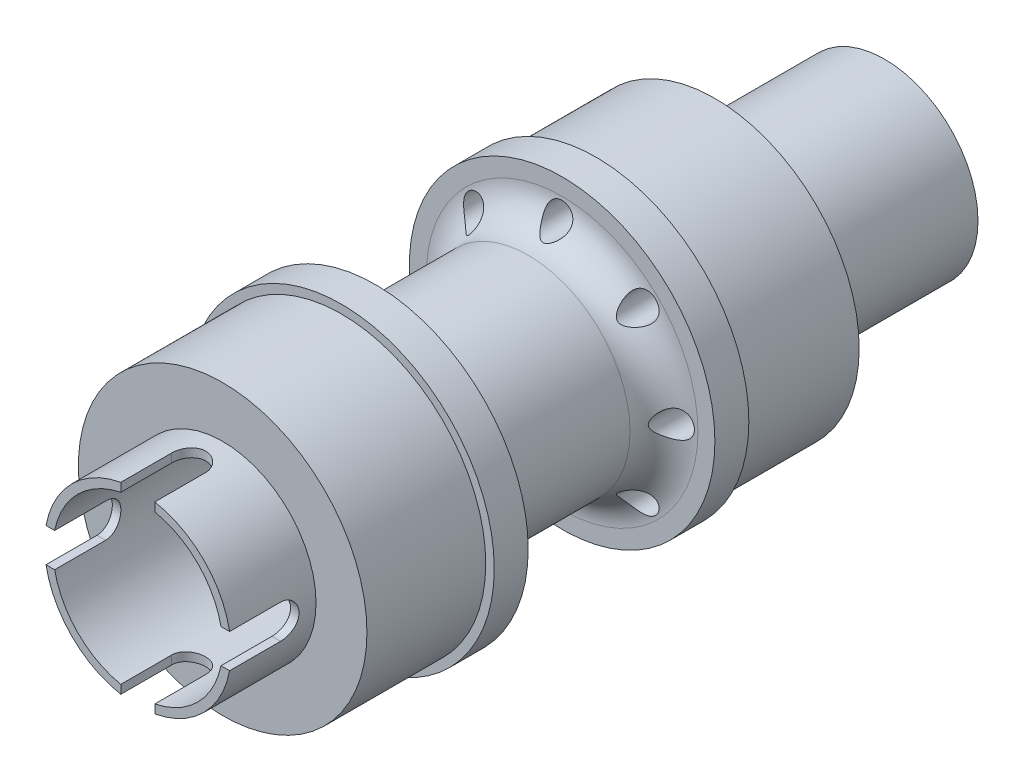
from build123d import *

# Parameters (mm, degrees)
ESQUISSE1_R                                   = 5.5
ESQUISSE1_R_2                                 = 4.5
BOSS_EXTRU_1_DEPTH                            = 10
ESQUISSE3_R                                   = 8.5
ESQUISSE3_R_2                                 = 5
BOSS_EXTRU_3_DEPTH                            = 7
ESQUISSE4_R                                   = 9
ESQUISSE4_R_2                                 = 5
BOSS_EXTRU_4_DEPTH                            = 2
ESQUISSE7_R                                   = 6
ESQUISSE7_R_2                                 = 5
BOSS_EXTRU_7_DEPTH                            = 11
ESQUISSE8_R                                   = 9
ESQUISSE8_R_2                                 = 5
BOSS_EXTRU_8_DEPTH                            = 2
ESQUISSE15_R                                  = 8.5
ESQUISSE15_R_2                                = 5
BOSS_EXTRU_9_DEPTH                            = 7
ESQUISSE16_R                                  = 5.5
ESQUISSE16_R_2                                = 5
BOSS_EXTRU_10_DEPTH                           = 5
ESQUISSE17_W                                  = 20
ESQUISSE17_H                                  = 2
ESQUISSE17_W_2                                = 2
ESQUISSE17_H_2                                = 20
ENL_V_MAT_EXTRU_1_DEPTH                       = 4
TROU_POUR_TARAUDAGE_POUR_TROU_TARAUD_M2_D     = 1.6
TROU_POUR_TARAUDAGE_POUR_TROU_TARAUD_M2_DEPTH = 9
CONG_1_R                                      = 2
CONG_5_R                                      = 1
CONG_6_START                                  = 5.354529638
CONG_6_DEPTH                                  = 0.053797275
CONG_6_START_2                                = 4.898979297
CONG_6_2_DEPTH                                = 0.601020703
CONG_6_START_3                                = 40
CONG_6_3_DEPTH                                = 4.0000001
CONG_7_R                                      = 1
CONG_8_R                                      = 1


with BuildPart() as part:
    # Esquisse1 → Boss.-Extru.1 (new body)
    with BuildSketch(Plane.XY):
        Circle(ESQUISSE1_R)
        Circle(ESQUISSE1_R_2, mode=Mode.SUBTRACT)
    extrude(amount=BOSS_EXTRU_1_DEPTH)

    # Esquisse3 → Boss.-Extru.3 (add)
    with BuildSketch(Plane.XY.offset(10)):
        Circle(ESQUISSE3_R)
        Circle(ESQUISSE3_R_2, mode=Mode.SUBTRACT)
    extrude(amount=BOSS_EXTRU_3_DEPTH)

    # Esquisse4 → Boss.-Extru.4 (add)
    with BuildSketch(Plane.XY.offset(17)):
        Circle(ESQUISSE4_R)
        Circle(ESQUISSE4_R_2, mode=Mode.SUBTRACT)
    extrude(amount=BOSS_EXTRU_4_DEPTH)

    # Esquisse7 → Boss.-Extru.7 (add)
    with BuildSketch(Plane.XY.offset(19)):
        Circle(ESQUISSE7_R)
        Circle(ESQUISSE7_R_2, mode=Mode.SUBTRACT)
    extrude(amount=BOSS_EXTRU_7_DEPTH)

    # Esquisse8 → Boss.-Extru.8 (add)
    with BuildSketch(Plane.XY.offset(30)):
        Circle(ESQUISSE8_R)
        Circle(ESQUISSE8_R_2, mode=Mode.SUBTRACT)
    extrude(amount=BOSS_EXTRU_8_DEPTH)

    # Esquisse15 → Boss.-Extru.9 (add)
    with BuildSketch(Plane.XY.offset(32)):
        Circle(ESQUISSE15_R)
        Circle(ESQUISSE15_R_2, mode=Mode.SUBTRACT)
    extrude(amount=BOSS_EXTRU_9_DEPTH)

    # Esquisse16 → Boss.-Extru.10 (add)
    with BuildSketch(Plane.XY.offset(39)):
        Circle(ESQUISSE16_R)
        Circle(ESQUISSE16_R_2, mode=Mode.SUBTRACT)
    extrude(amount=BOSS_EXTRU_10_DEPTH)

    # Esquisse17 → Enlèv. mat.-Extru.1 (cut)
    with BuildSketch(Plane.XY.offset(44)):
        Rectangle(ESQUISSE17_W, ESQUISSE17_H)
        Rectangle(ESQUISSE17_W_2, ESQUISSE17_H_2)
    extrude(amount=-ENL_V_MAT_EXTRU_1_DEPTH, mode=Mode.SUBTRACT)

    # Trou pour taraudage pour trou taraudé M21
    with Locations(Plane(origin=(0, 0, 10), x_dir=(-1, 0, 0), z_dir=(0, 0, -1))):
        with Locations((-7, 0), (-4.949747468, 4.949747468), (0, 7), (4.949747468, 4.949747468), (7, 0), (4.949747468, -4.949747468), (0, -7), (-4.949747468, -4.949747468), (0, 0)):
            Hole(TROU_POUR_TARAUDAGE_POUR_TROU_TARAUD_M2_D / 2, depth=TROU_POUR_TARAUDAGE_POUR_TROU_TARAUD_M2_DEPTH)

    # Congé1
    # the kernel refuses this fillet: 2 mm, written as the material it adds along each edge
    with BuildSketch(Plane(origin=(0, 0, 30), x_dir=(1, 0, 0), z_dir=(0, -1, 0))) as cong_1_piece_1:
        with BuildLine():
            CenterArc((6 + CONG_1_R, -CONG_1_R), CONG_1_R, 90, 90)
            Line((6 + CONG_1_R, 0), (6, 0))
            Line((6, 0), (6, -CONG_1_R))
        make_face()
    revolve(axis=Axis((0, 0, 30), (0, 0, 1)))
    with BuildSketch(Plane(origin=(0, 0, 19), x_dir=(1, 0, 0), z_dir=(0, -1, 0))) as cong_1_piece_2_section:
        with BuildLine():
            CenterArc((6 + CONG_1_R, CONG_1_R), CONG_1_R, 180, 90)
            Line((6, CONG_1_R), (6, 0))
            Line((6, 0), (6 + CONG_1_R, 0))
        make_face()
    cong_1_piece_2 = revolve(axis=Axis((0, 0, 19), (0, 0, 1)), mode=Mode.PRIVATE)
    cong_1_piece_2 = cong_1_piece_2 - Plane(origin=(-4.949747468, -4.949747468, 19), x_dir=(1, 0, 0), z_dir=(0, 0, 1)) * Cylinder(0.8, 32, mode=Mode.PRIVATE)
    cong_1_piece_2 = cong_1_piece_2 - Plane(origin=(0, -7, 19), x_dir=(1, 0, 0), z_dir=(0, 0, 1)) * Cylinder(0.8, 32, mode=Mode.PRIVATE)
    cong_1_piece_2 = cong_1_piece_2 - Plane(origin=(4.949747468, -4.949747468, 19), x_dir=(1, 0, 0), z_dir=(0, 0, 1)) * Cylinder(0.8, 32, mode=Mode.PRIVATE)
    cong_1_piece_2 = cong_1_piece_2 - Plane(origin=(-7, 0, 19), x_dir=(1, 0, 0), z_dir=(0, 0, 1)) * Cylinder(0.8, 32, mode=Mode.PRIVATE)
    cong_1_piece_2 = cong_1_piece_2 - Plane(origin=(-4.949747468, 4.949747468, 19), x_dir=(1, 0, 0), z_dir=(0, 0, 1)) * Cylinder(0.8, 32, mode=Mode.PRIVATE)
    cong_1_piece_2 = cong_1_piece_2 - Plane(origin=(7, 0, 19), x_dir=(1, 0, 0), z_dir=(0, 0, 1)) * Cylinder(0.8, 32, mode=Mode.PRIVATE)
    cong_1_piece_2 = cong_1_piece_2 - Plane(origin=(0, 7, 19), x_dir=(1, 0, 0), z_dir=(0, 0, 1)) * Cylinder(0.8, 32, mode=Mode.PRIVATE)
    cong_1_piece_2 = cong_1_piece_2 - Plane(origin=(4.949747468, 4.949747468, 19), x_dir=(1, 0, 0), z_dir=(0, 0, 1)) * Cylinder(0.8, 32, mode=Mode.PRIVATE)
    add(cong_1_piece_2)

    # Congé5
    cong_5_edges = [part.edges().sort_by_distance(p)[0] for p in [
        (1, -5.153653199, 40),
        (-1, -5.153653199, 40),
    ]]
    fillet(cong_5_edges, radius=CONG_5_R - 0.0001)  # a hair under: the kernel refuses the full size

    # Congé6: read off the stored shape, not the designer's step
    # Congé6 outline → Congé6 (add)
    with BuildSketch(Plane.YZ.offset(CONG_6_START)):
        with BuildLine():
            ThreePointArc((1, 41), (0.707106781, 40.292893219), (0, 40))
            Line((0, 40), (1, 40))
            Line((1, 40), (1, 41))
        make_face()
        with BuildLine():
            ThreePointArc((0, 40), (-0.707106781, 40.292893219), (-1, 41))
            Line((-1, 41), (-1, 40))
            Line((-1, 40), (0, 40))
        make_face()
    extrude(amount=CONG_6_DEPTH)

    # Cong_6 2 outline → Cong_6 2 (add)
    with BuildSketch(Plane.YZ.offset(CONG_6_START_2)):
        with BuildLine():
            ThreePointArc((1, 41), (0.707106781, 40.292893219), (0, 40))
            Line((0, 40), (1, 40))
            Line((1, 40), (1, 41))
        make_face()
        with BuildLine():
            ThreePointArc((0, 40), (-0.707106781, 40.292893219), (-1, 41))
            Line((-1, 41), (-1, 40))
            Line((-1, 40), (0, 40))
        make_face()
    extrude(amount=CONG_6_2_DEPTH)

    # Cong_6 3 outline → Cong_6 3 (cut)
    with BuildSketch(Plane.XY.offset(CONG_6_START_3)):
        with BuildLine():
            Line((5.5, -1), (5.5, 0))
            ThreePointArc((5.5, 0), (5.477033779, -0.502096593), (5.408326913, -1))
            Line((5.408326913, -1), (5.5, -1))
        make_face()
        with BuildLine():
            ThreePointArc((5.408326913, 1), (5.477033779, 0.502096593), (5.5, 0))
            Line((5.5, 0), (5.5, 1))
            Line((5.5, 1), (5.408326913, 1))
        make_face()
        with BuildLine():
            Line((4.898979478, 1.000000037), (4.898979478, -1.000000037))
            ThreePointArc((4.898979478, -1.000000037), (5, 0), (4.898979478, 1.000000037))
        make_face()
    extrude(amount=CONG_6_3_DEPTH, mode=Mode.SUBTRACT)

    # Congé7
    cong_7_edges = [part.edges().sort_by_distance(p)[0] for p in [
        (-1, 5.153653199, 40),
        (1, 5.153653199, 40),
    ]]
    fillet(cong_7_edges, radius=CONG_7_R - 0.0001)  # a hair under: the kernel refuses the full size

    # Congé8
    cong_8_edges = [part.edges().sort_by_distance(p)[0] for p in [
        (-5.153653199, 1, 40),
        (-5.153653199, -1, 40),
    ]]
    fillet(cong_8_edges, radius=CONG_8_R - 0.0001)  # a hair under: the kernel refuses the full size


solid = part.part
